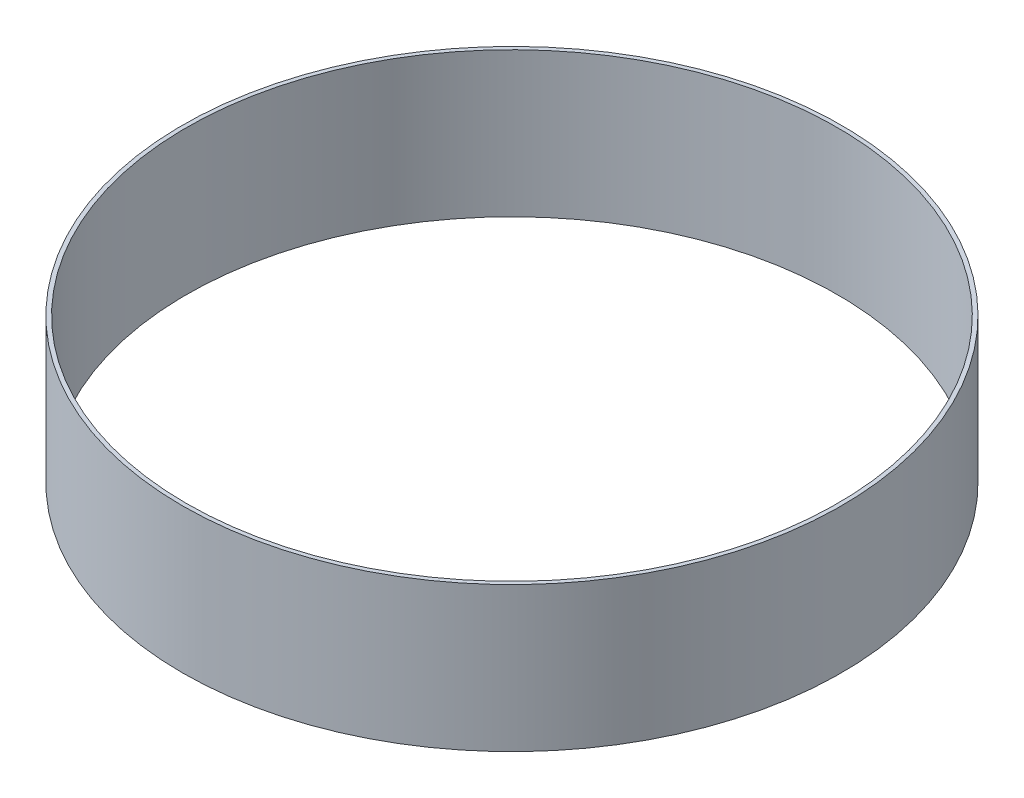
from build123d import *

# Parameters (mm, degrees)
SKETCH1_R           = 260.35
SKETCH1_R_2         = 257.175
BOSS_EXTRUDE1_DEPTH = 114.3


with BuildPart() as part:
    # Sketch1 → Boss-Extrude1 (new body)
    with BuildSketch(Plane(origin=(0, 0, 0), x_dir=(1, 0, 0), z_dir=(0, 1, 0))):
        Circle(SKETCH1_R)
        Circle(SKETCH1_R_2, mode=Mode.SUBTRACT)
    extrude(amount=BOSS_EXTRUDE1_DEPTH)


solid = part.part
